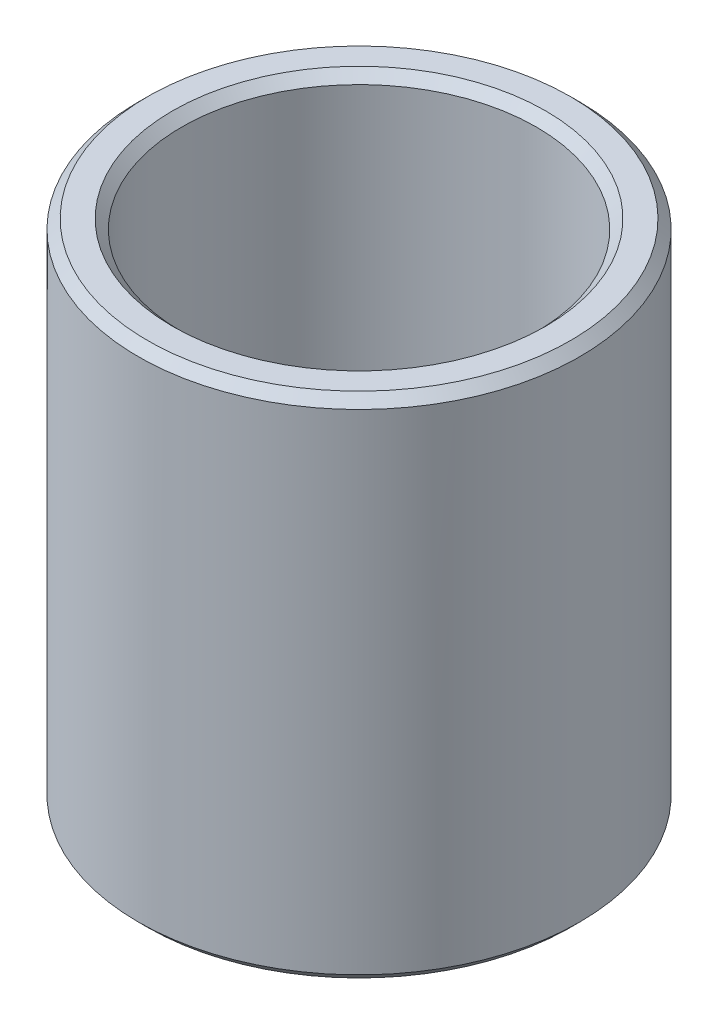
from build123d import *

# Parameters (mm, degrees)
SKETCH1_R           = 32.5
BOSS_EXTRUDE1_DEPTH = 74.843336492
SKETCH2_R           = 26.110354892
CUT_EXTRUDE1_DEPTH  = 88.82952247
CHAMFER1_SIZE       = 1.370464161


with BuildPart() as part:
    # Sketch1 → Boss-Extrude1 (new body)
    with BuildSketch(Plane(origin=(0, 0, 0), x_dir=(1, 0, 0), z_dir=(0, 1, 0))):
        Circle(SKETCH1_R)
    extrude(amount=BOSS_EXTRUDE1_DEPTH)

    # Sketch2 → Cut-Extrude1 (cut, through all)
    with BuildSketch(Plane(origin=(0, 0, 0), x_dir=(1, 0, 0), z_dir=(0, 1, 0))):
        Circle(SKETCH2_R)
    extrude(amount=CUT_EXTRUDE1_DEPTH, mode=Mode.SUBTRACT)

    # Chamfer1
    chamfer1_edges = [part.edges().sort_by_distance(p)[0] for p in [
        (-26.110354892, 74.843336492, 0),
        (-26.110354892, 0, 0),
        (-32.5, 0, 0),
        (-32.5, 74.843336492, 0),
    ]]
    chamfer(chamfer1_edges, length=CHAMFER1_SIZE)


solid = part.part
